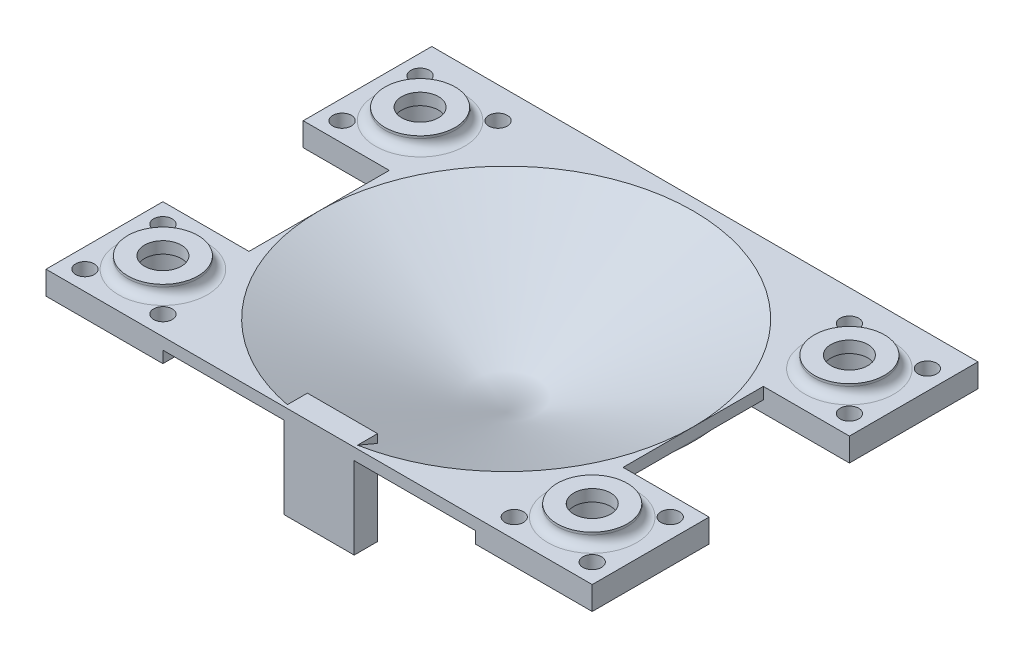
from build123d import *

# Parameters (mm, degrees)
BOSS_EXTRUDE1_START                  = -3.175
BOSS_EXTRUDE1_DEPTH                  = 3.175
SKETCH4_W                            = 31.75
SKETCH4_H                            = 31.75
SKETCH4_R                            = 7.5
BOSS_EXTRUDE2_DEPTH                  = 6.35
CUT_EXTRUDE1_REACH                   = 95.422
F_8_0_199_DIAMETER_HOLE1_D           = 5.0546
F_8_0_199_DIAMETER_HOLE1_CSINK_D     = 6.3246
F_8_0_199_DIAMETER_HOLE1_CSINK_ANGLE = 90
MIRROR4_COPY_1_SKETCH_W              = 31.75
MIRROR4_COPY_1_SKETCH_H              = 31.75
MIRROR4_COPY_1_SKETCH_R              = 7.5
MIRROR4_COPY_1_DEPTH                 = 6.35
MIRROR4_COPY_2_REACH                 = 95.422
MIRROR4_COPY_3_D                     = 5.0546
MIRROR4_COPY_3_CSINK_D               = 6.3246
MIRROR4_COPY_3_CSINK_ANGLE           = 90
SKETCH7_R                            = 9.525
SKETCH7_R_2                          = 5
BOSS_EXTRUDE3_DEPTH                  = 3.175
FILLET1_R                            = 2.54
SKETCH8_W                            = 19.05
SKETCH8_H                            = 25.4
BOSS_EXTRUDE4_DEPTH                  = 6.35
BOSS_EXTRUDE5_DEPTH                  = 3.175


with BuildPart() as part:
    # Sketch1 → Revolve1 (revolve)
    with BuildSketch(Plane.XY):
        Polygon((0, -21.941501914), (-50.8, 0), (-50.8, -3.458498086), (0, -25.4), align=None)
    revolve(axis=Axis((0, -55, 0), (0, 1, 0)))

    # Sketch3 → Boss-Extrude1 (add)
    with BuildSketch(Plane(origin=(0, 0, 0), x_dir=(1, 0, 0), z_dir=(0, 1, 0)).offset(BOSS_EXTRUDE1_START)):
        with BuildLine():
            Line((-50.8, 8e-09), (-50.8, -50.8))
            Line((-50.8, -50.8), (0, -50.8))
            ThreePointArc((0, -50.8), (-35.921024487, -35.921024482), (-50.8, 8e-09))
        make_face()
        with BuildLine():
            ThreePointArc((50.8, 0), (35.921024484, -35.921024484), (0, -50.8))
            Line((0, -50.8), (50.8, -50.8))
            Line((50.8, -50.8), (50.8, 0))
        make_face()
        with BuildLine():
            Line((-50.8, 50.8), (-50.8, 8e-09))
            ThreePointArc((-50.8, 8e-09), (-35.921024463, 35.921024505), (5.1e-08, 50.8))
            Line((5.1e-08, 50.8), (-50.8, 50.8))
        make_face()
        with BuildLine():
            ThreePointArc((5.1e-08, 50.8), (35.921024502, 35.921024466), (50.8, 0))
            Line((50.8, 0), (50.8, 50.8))
            Line((50.8, 50.8), (5.1e-08, 50.8))
        make_face()
    extrude(amount=BOSS_EXTRUDE1_DEPTH)

    # Sketch4 → Boss-Extrude2 (add)
    with BuildSketch(Plane(origin=(0, 0, 0), x_dir=(1, 0, 0), z_dir=(0, 1, 0))):
        with Locations((-58.3, -34.925)):
            Rectangle(SKETCH4_W, SKETCH4_H)
        with Locations((-58.3, -34.925)):
            Circle(SKETCH4_R, mode=Mode.SUBTRACT)
    boss_extrude2 = extrude(amount=-BOSS_EXTRUDE2_DEPTH)

    # Cut-Extrude1: up to this cone (the profile starts inside it)
    cut_extrude1_end = Plane(origin=(0, 0, 0), z_dir=(0, 1, 0)).offset(-21.941500914) * Cone(2.315e-06, 390.497693855, 168.663500914, align=(Align.CENTER, Align.CENTER, Align.MIN), mode=Mode.PRIVATE)
    # Sketch4<4> → Cut-Extrude1 (cut, up to the surface)
    with BuildSketch(Plane(origin=(0, 0, 0), x_dir=(1, 0, 0), z_dir=(0, 1, 0)), mode=Mode.PRIVATE) as cut_extrude1_sk1:
        with BuildLine():
            Line((-42.425, -19.05), (-47.092860393, -19.05))
            ThreePointArc((-47.092860393, -19.05), (-44.979207057, -23.611669415), (-42.425, -27.942071774))
            Line((-42.425, -27.942071774), (-42.425, -19.05))
        make_face()
    cut_extrude1_tool1 = extrude(cut_extrude1_sk1.sketch, amount=-CUT_EXTRUDE1_REACH, mode=Mode.PRIVATE) & cut_extrude1_end
    cut_extrude1 = cut_extrude1_tool1.solids().sort_by_distance((-44.045331, 0, 22.12762))[0]
    add(cut_extrude1, mode=Mode.SUBTRACT)

    # #8 (0.199) Diameter Hole1 (through all)
    with Locations(Plane(origin=(0, -6.35, 0), x_dir=(-1, 0, 0), z_dir=(0, -1, 0))):
        with Locations((68.889150429, -24.335849571), (68.889150429, -45.514150429), (47.710849571, -45.514150429)):
            f_8_0_199_diameter_hole1 = CounterSinkHole(F_8_0_199_DIAMETER_HOLE1_D / 2, F_8_0_199_DIAMETER_HOLE1_CSINK_D / 2, counter_sink_angle=F_8_0_199_DIAMETER_HOLE1_CSINK_ANGLE)

    # Mirror3: Boss-Extrude2, Cut-Extrude1, #8 (0.199) Diameter Hole1 across plane
    add(boss_extrude2.mirror(Plane.XY))
    add(cut_extrude1.mirror(Plane.XY), mode=Mode.SUBTRACT)
    add(f_8_0_199_diameter_hole1.mirror(Plane.XY), mode=Mode.SUBTRACT)

    # Mirror4: Boss-Extrude2, Cut-Extrude1, #8 (0.199) Diameter Hole1 across plane
    add(boss_extrude2.mirror(Plane(origin=(0, 0, 0), x_dir=(0, 0, 1), z_dir=(1, 0, 0))))
    add(cut_extrude1.mirror(Plane(origin=(0, 0, 0), x_dir=(0, 0, 1), z_dir=(1, 0, 0))), mode=Mode.SUBTRACT)
    add(f_8_0_199_diameter_hole1.mirror(Plane(origin=(0, 0, 0), x_dir=(0, 0, 1), z_dir=(1, 0, 0))), mode=Mode.SUBTRACT)

    # Mirror4 copy 1 sketch → Mirror4 copy 1 (add)
    with BuildSketch(Plane(origin=(0, 0, 0), x_dir=(-1, 0, 0), z_dir=(0, 1, 0))):
        with Locations((-58.3, -34.925)):
            Rectangle(MIRROR4_COPY_1_SKETCH_W, MIRROR4_COPY_1_SKETCH_H)
        with Locations((-58.3, -34.925)):
            Circle(MIRROR4_COPY_1_SKETCH_R, mode=Mode.SUBTRACT)
    extrude(amount=-MIRROR4_COPY_1_DEPTH)

    # Mirror4 copy 2: up to this cone (the profile starts inside it)
    mirror4_copy_2_end = Plane(origin=(0, 0, 0), z_dir=(0, 1, 0)).offset(-21.941500914) * Cone(2.315e-06, 390.497693855, 168.663500914, align=(Align.CENTER, Align.CENTER, Align.MIN), mode=Mode.PRIVATE)
    # Mirror4 copy 2 sketch → Mirror4 copy 2 (cut, up to the surface)
    with BuildSketch(Plane(origin=(0, 0, 0), x_dir=(-1, 0, 0), z_dir=(0, 1, 0)), mode=Mode.PRIVATE) as mirror4_copy_2_sk1:
        with BuildLine():
            Line((-42.425, -19.05), (-47.092860393, -19.05))
            ThreePointArc((-47.092860393, -19.05), (-44.979207057, -23.611669415), (-42.425, -27.942071774))
            Line((-42.425, -27.942071774), (-42.425, -19.05))
        make_face()
    mirror4_copy_2_tool1 = extrude(mirror4_copy_2_sk1.sketch, amount=-MIRROR4_COPY_2_REACH, mode=Mode.PRIVATE) & mirror4_copy_2_end
    add(mirror4_copy_2_tool1.solids().sort_by_distance((-44.045331, 0, 22.12762))[0], mode=Mode.SUBTRACT)

    # Mirror4 copy 3 (through all)
    with Locations(Plane.XZ.offset(6.35)):
        with Locations((68.889150429, -24.335849571), (68.889150429, -45.514150429), (47.710849571, -45.514150429)):
            CounterSinkHole(MIRROR4_COPY_3_D / 2, MIRROR4_COPY_3_CSINK_D / 2, counter_sink_angle=MIRROR4_COPY_3_CSINK_ANGLE)

    # Sketch7 → Boss-Extrude3 (add)
    # profile 1 of 4: a face of its own
    with BuildSketch(Plane(origin=(0, 0, 0), x_dir=(1, 0, 0), z_dir=(0, 1, 0))):
        with Locations((-58.3, 34.925)):
            Circle(SKETCH7_R)
        with Locations((-58.3, 34.925)):
            Circle(SKETCH7_R_2, mode=Mode.SUBTRACT)
    # profile 2 of 4: a face of its own
    with BuildSketch(Plane(origin=(0, 0, 0), x_dir=(1, 0, 0), z_dir=(0, 1, 0))):
        with Locations((-58.3, -34.925)):
            Circle(SKETCH7_R)
        with Locations((-58.3, -34.925)):
            Circle(SKETCH7_R_2, mode=Mode.SUBTRACT)
    # profile 3 of 4: a face of its own
    with BuildSketch(Plane(origin=(0, 0, 0), x_dir=(1, 0, 0), z_dir=(0, 1, 0))):
        with Locations((58.3, -34.925)):
            Circle(SKETCH7_R)
        with Locations((58.3, -34.925)):
            Circle(SKETCH7_R_2, mode=Mode.SUBTRACT)
    # profile 4 of 4: a face of its own
    with BuildSketch(Plane(origin=(0, 0, 0), x_dir=(1, 0, 0), z_dir=(0, 1, 0))):
        with Locations((58.3, 34.925)):
            Circle(SKETCH7_R)
        with Locations((58.3, 34.925)):
            Circle(SKETCH7_R_2, mode=Mode.SUBTRACT)
    extrude(amount=BOSS_EXTRUDE3_DEPTH)

    # Fillet1
    fillet1_edges = [part.edges().sort_by_distance(p)[0] for p in [
        (48.775, 0, 34.925),
        (48.775, 0, -34.925),
        (-67.825, 0, 34.925),
        (-67.825, 0, -34.925),
    ]]
    fillet(fillet1_edges, radius=FILLET1_R)

    # Sketch8 → Boss-Extrude4 (add)
    with BuildSketch(Plane(origin=(0, 0, 50.8), x_dir=(-1, 0, 0), z_dir=(0, 0, -1))):
        with Locations((0, -12.7)):
            Rectangle(SKETCH8_W, SKETCH8_H)
    extrude(amount=BOSS_EXTRUDE4_DEPTH)

    # Sketch13 → Boss-Extrude5 (add)
    with BuildSketch(Plane(origin=(0, 0, -50.8), x_dir=(-1, 0, 0), z_dir=(0, 0, -1))):
        Polygon((0, 0), (-74.175, 0), (-74.175, -6.35), (-42.425, -6.35), (-42.425, -3.175), (0, -3.175), (42.425, -3.175), (42.425, -6.35), (74.175, -6.35), (74.175, 0), align=None)
    extrude(amount=BOSS_EXTRUDE5_DEPTH)


solid = part.part
